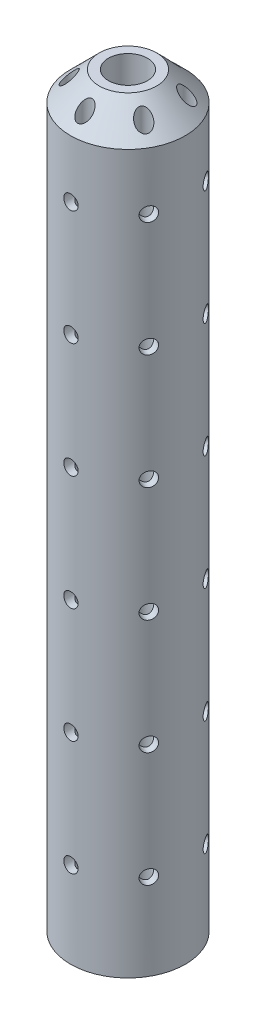
from build123d import *

# Parameters (mm, degrees)
SKETCH1_R               = 6.35
BOSS_EXTRUDE1_DEPTH     = 79.375
SKETCH2_R               = 6.35
SKETCH2_R_2             = 2.159
BOSS_EXTRUDE2_DEPTH     = 3.175
CHAMFER1_SIZE           = 3.175
SKETCH4_R               = 0.79375
CUT_EXTRUDE1_DEPTH      = 85.725
CUT_EXTRUDE2_REACH      = 86.957
CUT_EXTRUDE2_END_RADIUS = 0.79375
SKETCH3_R               = 0.79375
CIRPATTERN1_COUNT       = 6


with BuildPart() as part:
    # Sketch1 → Boss-Extrude1 (new body)
    with BuildSketch(Plane(origin=(0, 0, 0), x_dir=(1, 0, 0), z_dir=(0, 1, 0))):
        Circle(SKETCH1_R)
        Polygon((3.695503603, 0), (1.847751802, 3.2004), (-1.847751802, 3.2004), (-3.695503603, 0), (-1.847751802, -3.2004), (1.847751802, -3.2004), align=None, mode=Mode.SUBTRACT)
    extrude(amount=BOSS_EXTRUDE1_DEPTH)

    # Sketch2 → Boss-Extrude2 (add)
    with BuildSketch(Plane(origin=(0, 79.375, 0), x_dir=(1, 0, 0), z_dir=(0, 1, 0))):
        Circle(SKETCH2_R)
        Circle(SKETCH2_R_2, mode=Mode.SUBTRACT)
    extrude(amount=BOSS_EXTRUDE2_DEPTH)

    # Chamfer1
    chamfer1_edges = [part.edges().sort_by_distance(p)[0] for p in [
        (-6.35, 82.55, 0),
    ]]
    chamfer(chamfer1_edges, length=CHAMFER1_SIZE)

    # Sketch4 → Cut-Extrude1 (cut)
    with BuildSketch(Plane.XZ):
        with Locations((0, 4.7625)):
            Circle(SKETCH4_R)
    cut_extrude1 = extrude(amount=-CUT_EXTRUDE1_DEPTH, mode=Mode.SUBTRACT)

    # Cut-Extrude2: up to this cylinder (the profile starts outside it)
    cut_extrude2_end = Plane(origin=(0, 34.925, 4.7625), z_dir=(0, -1, 0)) * Cylinder(CUT_EXTRUDE2_END_RADIUS, 252.7015, mode=Mode.PRIVATE)
    # Sketch3 → Cut-Extrude2 (cut, up to the surface)
    with BuildSketch(Plane.XY.offset(12.7), mode=Mode.PRIVATE) as cut_extrude2_sk1:
        with Locations((0, 73.025)):
            Circle(SKETCH3_R)
    cut_extrude2_tool1 = extrude(cut_extrude2_sk1.sketch, amount=-CUT_EXTRUDE2_REACH, mode=Mode.PRIVATE) - cut_extrude2_end
    # Sketch3 → Cut-Extrude2 (cut, up to the surface)
    with BuildSketch(Plane.XY.offset(12.7), mode=Mode.PRIVATE) as cut_extrude2_sk2:
        with Locations((0, 60.325)):
            Circle(SKETCH3_R)
    cut_extrude2_tool2 = extrude(cut_extrude2_sk2.sketch, amount=-CUT_EXTRUDE2_REACH, mode=Mode.PRIVATE) - cut_extrude2_end
    # Sketch3 → Cut-Extrude2 (cut, up to the surface)
    with BuildSketch(Plane.XY.offset(12.7), mode=Mode.PRIVATE) as cut_extrude2_sk3:
        with Locations((0, 47.625)):
            Circle(SKETCH3_R)
    cut_extrude2_tool3 = extrude(cut_extrude2_sk3.sketch, amount=-CUT_EXTRUDE2_REACH, mode=Mode.PRIVATE) - cut_extrude2_end
    # Sketch3 → Cut-Extrude2 (cut, up to the surface)
    with BuildSketch(Plane.XY.offset(12.7), mode=Mode.PRIVATE) as cut_extrude2_sk4:
        with Locations((0, 34.925)):
            Circle(SKETCH3_R)
    cut_extrude2_tool4 = extrude(cut_extrude2_sk4.sketch, amount=-CUT_EXTRUDE2_REACH, mode=Mode.PRIVATE) - cut_extrude2_end
    # Sketch3 → Cut-Extrude2 (cut, up to the surface)
    with BuildSketch(Plane.XY.offset(12.7), mode=Mode.PRIVATE) as cut_extrude2_sk5:
        with Locations((0, 22.225)):
            Circle(SKETCH3_R)
    cut_extrude2_tool5 = extrude(cut_extrude2_sk5.sketch, amount=-CUT_EXTRUDE2_REACH, mode=Mode.PRIVATE) - cut_extrude2_end
    # Sketch3 → Cut-Extrude2 (cut, up to the surface)
    with BuildSketch(Plane.XY.offset(12.7), mode=Mode.PRIVATE) as cut_extrude2_sk6:
        with Locations((0, 9.525)):
            Circle(SKETCH3_R)
    cut_extrude2_tool6 = extrude(cut_extrude2_sk6.sketch, amount=-CUT_EXTRUDE2_REACH, mode=Mode.PRIVATE) - cut_extrude2_end
    # Sketch3 → Cut-Extrude2 (cut, up to the surface)
    with BuildSketch(Plane.XY.offset(12.7), mode=Mode.PRIVATE) as cut_extrude2_sk7:
        with Locations((0, -3.175)):
            Circle(SKETCH3_R)
    cut_extrude2_tool7 = extrude(cut_extrude2_sk7.sketch, amount=-CUT_EXTRUDE2_REACH, mode=Mode.PRIVATE) - cut_extrude2_end
    cut_extrude2 = cut_extrude2_tool1.solids().sort_by_distance((0, 73.025, 12.7))[0] + cut_extrude2_tool2.solids().sort_by_distance((0, 60.325, 12.7))[0] + cut_extrude2_tool3.solids().sort_by_distance((0, 47.625, 12.7))[0] + cut_extrude2_tool4.solids().sort_by_distance((0, 34.925, 12.7))[0] + cut_extrude2_tool5.solids().sort_by_distance((0, 22.225, 12.7))[0] + cut_extrude2_tool6.solids().sort_by_distance((0, 9.525, 12.7))[0] + cut_extrude2_tool7.solids().sort_by_distance((0, -3.175, 12.7))[0]
    add(cut_extrude2, mode=Mode.SUBTRACT)

    # CirPattern1: Cut-Extrude1, Cut-Extrude2 ×6 about axis
    cirpattern1_axis = Axis((0, 82.55, 0), (0, 1, 0))
    add([cut_extrude1.rotate(cirpattern1_axis, i * 360 / CIRPATTERN1_COUNT) for i in range(1, CIRPATTERN1_COUNT)], mode=Mode.SUBTRACT)
    add([cut_extrude2.rotate(cirpattern1_axis, i * 360 / CIRPATTERN1_COUNT) for i in range(1, CIRPATTERN1_COUNT)], mode=Mode.SUBTRACT)


solid = part.part
